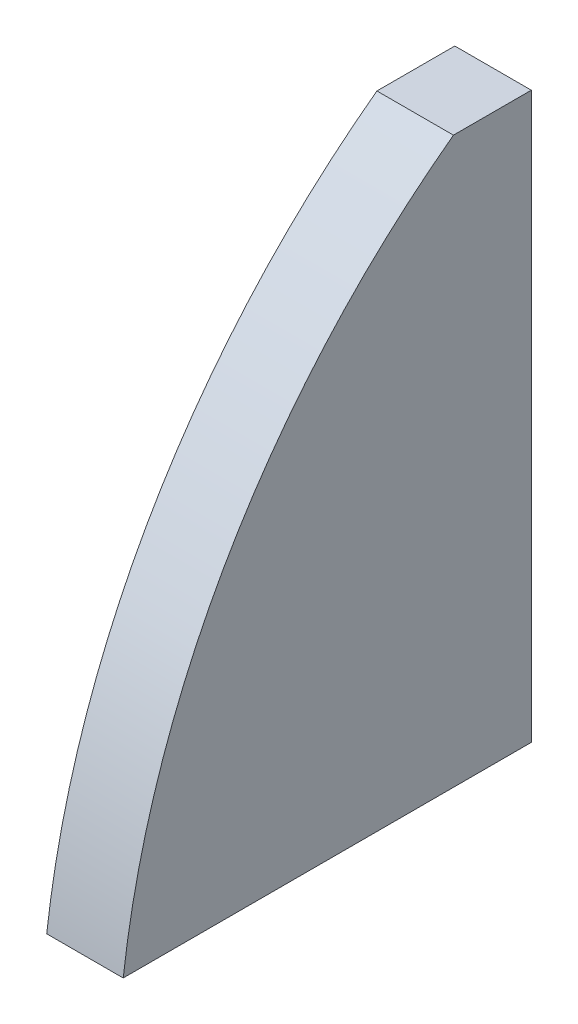
from build123d import *

# Parameters (mm, degrees)
EXTRUDE_1_DEPTH     = 150
CHAMFER_START       = 1307.207357733
CHAMFER_1_OUTLINE_W = 152
CHAMFER_1_OUTLINE_H = 156
CHAMFER_1_DEPTH     = 100.792642267


with BuildPart() as part:
    # Эскиз1 → Бобышка-Вытянуть1 (new body)
    with BuildSketch(Plane(origin=(0, 0, 0), x_dir=(0, 0, -1), z_dir=(1, 0, 0))):
        with BuildLine():
            Line((-1612.645342287, 200), (-812.645342287, 200))
            Line((-812.645342287, 200), (-812.645342287, 1407.207357733))
            ThreePointArc((-812.645342287, 1407.207357733), (-1354.564921778, 897.651866086), (-1612.645342287, 200))
        make_face()
    extrude(amount=EXTRUDE_1_DEPTH)

    # Фаска1: read off the stored shape, not the designer's step
    # Фаска1 outline → Фаска1 (cut)
    with BuildSketch(Plane(origin=(0, 0, 0), x_dir=(1, 0, 0), z_dir=(0, 1, 0)).offset(CHAMFER_START)):
        with Locations((75, -889)):
            Rectangle(CHAMFER_1_OUTLINE_W, CHAMFER_1_OUTLINE_H)
    extrude(amount=CHAMFER_1_DEPTH, mode=Mode.SUBTRACT)


solid = part.part
